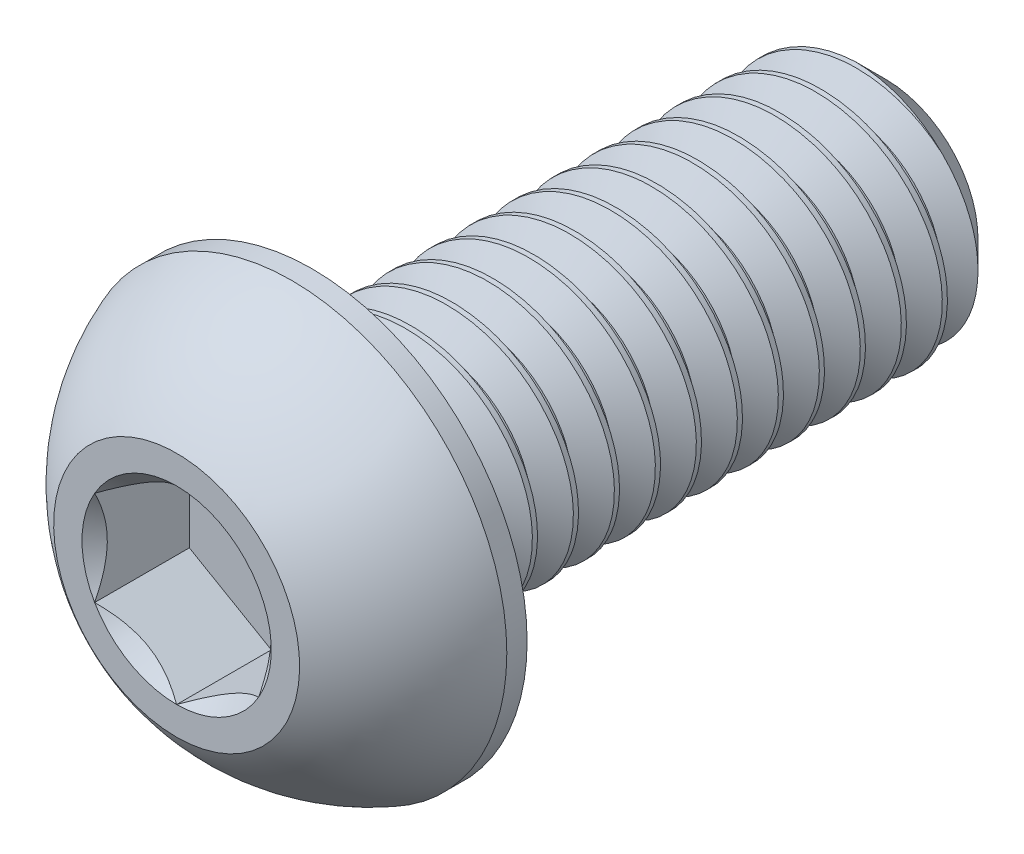
from build123d import *

# Parameters (mm, degrees)
SKETCH1_W          = 14
SKETCH1_H          = 3
CHAMFER1_SIZE      = 0.75
CUT_EXTRUDE2_DEPTH = 2.31
CUT_SWEEP1_PITCH   = 1


with BuildPart() as part:
    # Sketch1 → Revolve1 (revolve)
    with BuildSketch(Plane(origin=(0, 0, 0), x_dir=(0, 0, -1), z_dir=(1, 0, 0))):
        with Locations((10.3, 1.5)):
            Rectangle(SKETCH1_W, SKETCH1_H)
    revolve(axis=Axis((0, 0, -17.3), (0, 0, 1)))

    # Chamfer1
    chamfer1_edges = [part.edges().sort_by_distance(p)[0] for p in [
        (0, -3, -17.3),
    ]]
    chamfer(chamfer1_edges, length=CHAMFER1_SIZE)

    # Sketch7 → Revolve2 (revolve)
    with BuildSketch(Plane(origin=(0, 0, 0), x_dir=(0, 0, -1), z_dir=(1, 0, 0)), mode=Mode.PRIVATE) as revolve2_sk:
        with BuildLine():
            Line((2.805, 5.25), (3.3, 5.25))
            Line((3.3, 5.25), (3.3, 0))
            Line((3.3, 0), (0, 0))
            Line((0, 0), (0, 3))
            ThreePointArc((0, 3), (1.216479019, 4.356906156), (2.805, 5.25))
        make_face()
    revolve(revolve2_sk.sketch.rotate(Axis((0, 0, 0), (0, 0, -1)), 180), axis=Axis((0, 0, 0), (0, 0, -1)))

    # Sketch5 → Cut-Extrude2 (cut)
    with BuildSketch(Plane.XY):
        Polygon((2, -1.154700538), (2, 1.154700538), (0, 2.309401077), (-2, 1.154700538), (-2, -1.154700538), (0, -2.309401077), align=None)
    extrude(amount=-CUT_EXTRUDE2_DEPTH, mode=Mode.SUBTRACT)

    # Cut-Extrude3 cone 1 section (through the dimple's axis) → Cut-Extrude3 (revolve, cut)
    with BuildSketch(Plane(origin=(0, 0, 0), x_dir=(0, -1, 0), z_dir=(1, 0, 0))):
        Polygon((0, 0), (2.309401077, 0), (0, 2.309401077), align=None)
    revolve(axis=Axis((0, 0, 0), (0, 0, -1)), mode=Mode.SUBTRACT)

    # Cut-Sweep1: the profile of Sketch2 profile screwed along a right-hand helix of 15 turns, 8 arcs to a turn; built about Z, then put on its axis
    cut_sweep1_z = Axis((0, 0, 0), (0, 0, 1))
    cut_sweep1_corners = [(3.0003, 0, 0.750173205), (3.0003, 0, -0.125173205), (2.350480947, 0, 0.25), (2.350480947, 0, 0.375)]
    with BuildLine(mode=Mode.PRIVATE) as cut_sweep1_profile:
        Line(cut_sweep1_corners[0], cut_sweep1_corners[1])
        Line(cut_sweep1_corners[1], cut_sweep1_corners[2])
        Line(cut_sweep1_corners[2], cut_sweep1_corners[3])
        Line(cut_sweep1_corners[3], cut_sweep1_corners[0])
    cut_sweep1_cap = Face(cut_sweep1_profile.wire())
    cut_sweep1_turn_angles = [0, 22.5, 45, 67.5, 90, 112.5, 135, 157.5, 180, 202.5, 225, 247.5, 270, 292.5, 315, 337.5, 360]
    cut_sweep1_turn_weights = [1, 0.9238795325112867, 1, 0.9238795325112867, 1, 0.9238795325112867, 1, 0.9238795325112867, 1, 0.9238795325112867, 1, 0.9238795325112867, 1, 0.9238795325112867, 1, 0.9238795325112867, 1]
    cut_sweep1_turn_rails = [Edge.make_bspline([Vector(p[0], p[1], 0).rotate(cut_sweep1_z, cut_sweep1_turn_angles[k]) / cut_sweep1_turn_weights[k] + Vector(0, 0, p[2] + CUT_SWEEP1_PITCH * cut_sweep1_turn_angles[k] / 360) for k in range(17)], [0, 0, 0, 1, 1, 2, 2, 3, 3, 4, 4, 5, 5, 6, 6, 7, 7, 8, 8, 8], 2, cut_sweep1_turn_weights) for p in cut_sweep1_corners]
    cut_sweep1_turn_sides = [Face.make_surface_from_curves(cut_sweep1_turn_rails[p[0]], cut_sweep1_turn_rails[p[1]]) for p in [(0, 1), (1, 2), (2, 3), (3, 0)]]
    cut_sweep1 = Plane(origin=(0, 0, -17.3), x_dir=(0, 1, 0), z_dir=(0, 0, 1)) * Solid(Shell([*[p.moved(Location((0, 0, CUT_SWEEP1_PITCH * i))) for i in range(15) for p in cut_sweep1_turn_sides], cut_sweep1_cap, cut_sweep1_cap.rotate(cut_sweep1_z, 5400).moved(Location((0, 0, CUT_SWEEP1_PITCH * 5400 / 360)))]))
    add(cut_sweep1, mode=Mode.SUBTRACT)


solid = part.part
